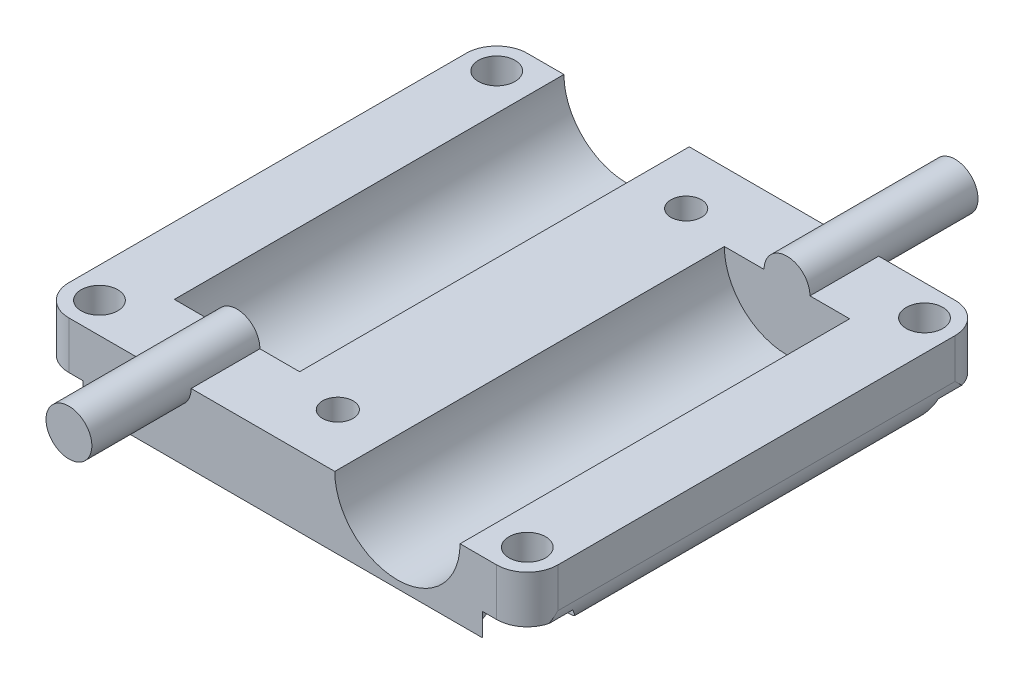
from build123d import *

# Parameters (mm, degrees)
SKETCH1_W           = 32
SKETCH1_H           = 6.5
BOSS_EXTRUDE1_DEPTH = 30
FILLET1_R           = 2
SKETCH2_R           = 4.1
CUT_EXTRUDE1_DEPTH  = 25.5
SKETCH3_R           = 4.1
CUT_EXTRUDE2_DEPTH  = 25.5
SKETCH5_W           = 32
SKETCH5_H           = 0.1
CUT_EXTRUDE3_DEPTH  = 37.629308734
SKETCH6_W           = 32
SKETCH6_H           = 1.8
CUT_EXTRUDE4_DEPTH  = 37.629308734
SKETCH7_R           = 2.2
CUT_EXTRUDE5_DEPTH  = 1.5
SKETCH8_R           = 1.2
CUT_EXTRUDE6_DEPTH  = 4
SKETCH9_R           = 1.2
CUT_EXTRUDE7_DEPTH  = 6
SKETCH10_R          = 2.2
CUT_EXTRUDE8_DEPTH  = 1.5
SKETCH11_R          = 1
CUT_EXTRUDE9_DEPTH  = 37.322647437
SKETCH12_R          = 1.7
CUT_EXTRUDE10_DEPTH = 1.5
SKETCH14_R          = 1.5
BOSS_EXTRUDE3_DEPTH = 11
SKETCH15_R          = 1.5
BOSS_EXTRUDE4_DEPTH = 11
FILLET2_R           = 2


with BuildPart() as part:
    # Sketch1 → Boss-Extrude1 (new body)
    with BuildSketch(Plane.XY):
        with Locations((3.954315745, -3.347843701)):
            Rectangle(SKETCH1_W, SKETCH1_H)
    extrude(amount=BOSS_EXTRUDE1_DEPTH)

    # Fillet1
    fillet1_edges = [part.edges().sort_by_distance(p)[0] for p in [
        (19.954315745, -3.347843701, 30),
        (-12.045684255, -3.347843701, 30),
        (19.954315745, -3.347843701, 0),
        (-12.045684255, -3.347843701, 0),
    ]]
    fillet(fillet1_edges, radius=FILLET1_R)

    # Sketch2 → Cut-Extrude1 (cut)
    with BuildSketch(Plane(origin=(0, 0, 0), x_dir=(-1, 0, 0), z_dir=(0, 0, -1))):
        with Locations((3.545684255, -0.197843701)):
            Circle(SKETCH2_R)
    extrude(amount=-CUT_EXTRUDE1_DEPTH, mode=Mode.SUBTRACT)

    # Sketch3 → Cut-Extrude2 (cut)
    with BuildSketch(Plane.XY.offset(30)):
        with Locations((11.454315745, -0.197843701)):
            Circle(SKETCH3_R)
    extrude(amount=-CUT_EXTRUDE2_DEPTH, mode=Mode.SUBTRACT)

    # Sketch5 → Cut-Extrude3 (cut, through all)
    with BuildSketch(Plane.XY.offset(30)):
        with Locations((3.954315745, -0.147843701)):
            Rectangle(SKETCH5_W, SKETCH5_H)
    extrude(amount=-CUT_EXTRUDE3_DEPTH, mode=Mode.SUBTRACT)

    # Sketch6 → Cut-Extrude4 (cut, through all)
    with BuildSketch(Plane.XY.offset(30)):
        with Locations((3.954315745, -5.697843701)):
            Rectangle(SKETCH6_W, SKETCH6_H)
    extrude(amount=-CUT_EXTRUDE4_DEPTH, mode=Mode.SUBTRACT)

    # Sketch7 → Cut-Extrude5 (cut)
    with BuildSketch(Plane.XZ.offset(4.797843701)):
        with Locations((-10.045684255, 2)):
            Circle(SKETCH7_R)
    extrude(amount=-CUT_EXTRUDE5_DEPTH, mode=Mode.SUBTRACT)

    # Sketch8 → Cut-Extrude6 (cut)
    with BuildSketch(Plane.XZ.offset(3.297843701)):
        with Locations((-10.045684255, 2)):
            Circle(SKETCH8_R)
    extrude(amount=-CUT_EXTRUDE6_DEPTH, mode=Mode.SUBTRACT)

    # Sketch9 → Cut-Extrude7 (cut)
    with BuildSketch(Plane.XZ.offset(4.797843701)):
        with Locations((-10.045684255, 28)):
            Circle(SKETCH9_R)
        with Locations((17.954315745, 28)):
            Circle(SKETCH9_R)
        with Locations((17.954315745, 2)):
            Circle(SKETCH9_R)
    extrude(amount=-CUT_EXTRUDE7_DEPTH, mode=Mode.SUBTRACT)

    # Sketch10 → Cut-Extrude8 (cut)
    with BuildSketch(Plane.XZ.offset(4.797843701)):
        with Locations((-10.045684255, 28)):
            Circle(SKETCH10_R)
        with Locations((17.954315745, 28)):
            Circle(SKETCH10_R)
        with Locations((17.954315745, 2)):
            Circle(SKETCH10_R)
    extrude(amount=-CUT_EXTRUDE8_DEPTH, mode=Mode.SUBTRACT)

    # Sketch11 → Cut-Extrude9 (cut, through all)
    with BuildSketch(Plane(origin=(0, -0.197843701, 0), x_dir=(1, 0, 0), z_dir=(0, 1, 0))):
        with Locations(Location((3.954315745, -3.6, 0), (0, 0, 270))):
            Circle(SKETCH11_R)
        with Locations(Location((3.954315745, -26.4, 0), (0, 0, 270))):
            Circle(SKETCH11_R)
    extrude(amount=-CUT_EXTRUDE9_DEPTH, mode=Mode.SUBTRACT)

    # Sketch12 → Cut-Extrude10 (cut)
    with BuildSketch(Plane.XZ.offset(4.797843701)):
        with Locations((3.954315745, 26.4)):
            Circle(SKETCH12_R)
        with Locations((3.954315745, 3.6)):
            Circle(SKETCH12_R)
    extrude(amount=-CUT_EXTRUDE10_DEPTH, mode=Mode.SUBTRACT)

    # Sketch14 → Boss-Extrude3 (add)
    with BuildSketch(Plane.XY.offset(4.5)):
        with Locations((11.454315745, -0.197843701)):
            Circle(SKETCH14_R)
    extrude(amount=-BOSS_EXTRUDE3_DEPTH)

    # Sketch15 → Boss-Extrude4 (add)
    with BuildSketch(Plane(origin=(0, 0, 25.5), x_dir=(-1, 0, 0), z_dir=(0, 0, -1))):
        with Locations((3.545684255, -0.197843701)):
            Circle(SKETCH15_R)
    extrude(amount=-BOSS_EXTRUDE4_DEPTH)

    # Fillet2
    # the kernel refuses this fillet: 2 mm, written as the material it takes off along each edge
    with BuildSketch(Plane(origin=(19.954315745, -4.797843701, 32.083484861), x_dir=(-1, 0, 0), z_dir=(0, 0, -1)), Plane(origin=(-12.045684255, -4.797843701, 32.083484861), x_dir=(0, 1, 0), z_dir=(0, 0, -1))) as fillet2_piece_1:
        with BuildLine():
            CenterArc((FILLET2_R, FILLET2_R), FILLET2_R, 180, 90)
            Line((0, FILLET2_R), (0, 0))
            Line((0, 0), (FILLET2_R, 0))
        make_face()
    extrude(amount=34.166969722, mode=Mode.SUBTRACT)


solid = part.part
